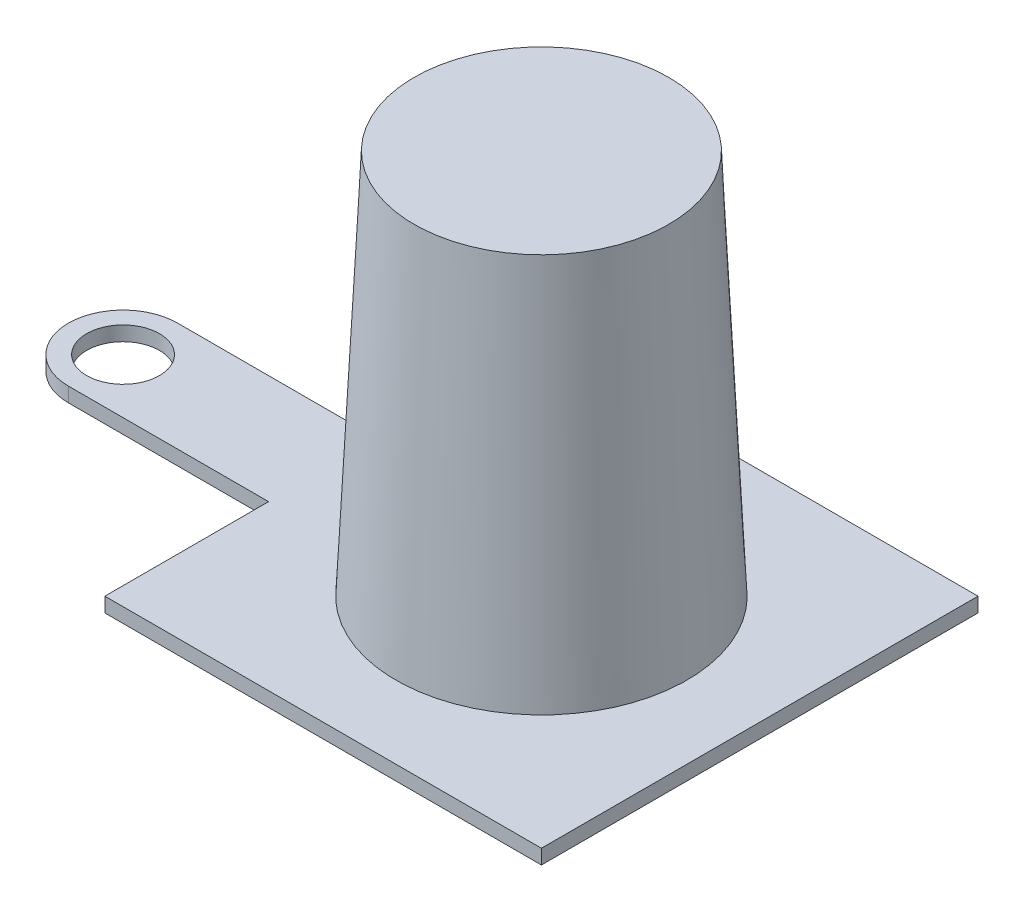
from build123d import *

# Parameters (mm, degrees)
SKETCH_1_W      = 12
SKETCH_1_H      = 12
SKETCH_1_W_2    = 7
SKETCH_1_H_2    = 3
SKETCH_1_R      = 1
EXTRUDE_1_DEPTH = 0.4
EXTRUDE_START   = 0.4
SKETCH_1_5_R    = 3.5
EXTRUDE_2_DEPTH = 10.6
SKETCH_1_6_R    = 4
EXTRUDE_3_DEPTH = 0.01
FILLET_1_R      = 1.5


with BuildPart() as part:
    # 草图1 → 凸台-拉伸1 (new body)
    # profile 1 of 2: a face of its own
    with BuildSketch(Plane(origin=(0, 0, 0), x_dir=(1, 0, 0), z_dir=(0, 1, 0))):
        Rectangle(SKETCH_1_W, SKETCH_1_H)
    # profile 2 of 2: a face of its own
    with BuildSketch(Plane(origin=(0, 0, 0), x_dir=(1, 0, 0), z_dir=(0, 1, 0))):
        with Locations((-9.5, 0)):
            Rectangle(SKETCH_1_W_2, SKETCH_1_H_2)
        with Locations(Location((-11.5, 0, 0), (0, 0, 270))):
            Circle(SKETCH_1_R, mode=Mode.SUBTRACT)
    extrude(amount=EXTRUDE_1_DEPTH)

    # 草图1<5> → 凸台-拉伸2 (add)
    with BuildSketch(Plane(origin=(0, 0, 0), x_dir=(1, 0, 0), z_dir=(0, 1, 0)).offset(EXTRUDE_START)):
        with Locations(Location((0, 0, 0), (0, 0, 90))):
            Circle(SKETCH_1_5_R)
    extrude(amount=EXTRUDE_2_DEPTH)

    # 草图1<6> → 凸台-拉伸3 (add)
    with BuildSketch(Plane(origin=(0, 0, 0), x_dir=(1, 0, 0), z_dir=(0, 1, 0)).offset(EXTRUDE_START)):
        with Locations(Location((0, 0, 0), (0, 0, 90))):
            Circle(SKETCH_1_6_R)
    extrude(amount=EXTRUDE_3_DEPTH)

    # loft up to a face of the part (loft_1)
    loft([Face(Wire([part.edges().sort_by_distance((-2.551390196, 11, 2.395914871))[0]])), Face(Wire([part.edges().sort_by_distance((-2.91587451, 0.4, 2.738188424))[0]]))])

    # 圆角1
    fillet_1_edges = [part.edges().sort_by_distance(p)[0] for p in [
        (-13, 0.2, 1.5),
        (-13, 0.2, -1.5),
    ]]
    fillet(fillet_1_edges, radius=FILLET_1_R - 0.0001)  # a hair under: the kernel refuses the full size


solid = part.part
